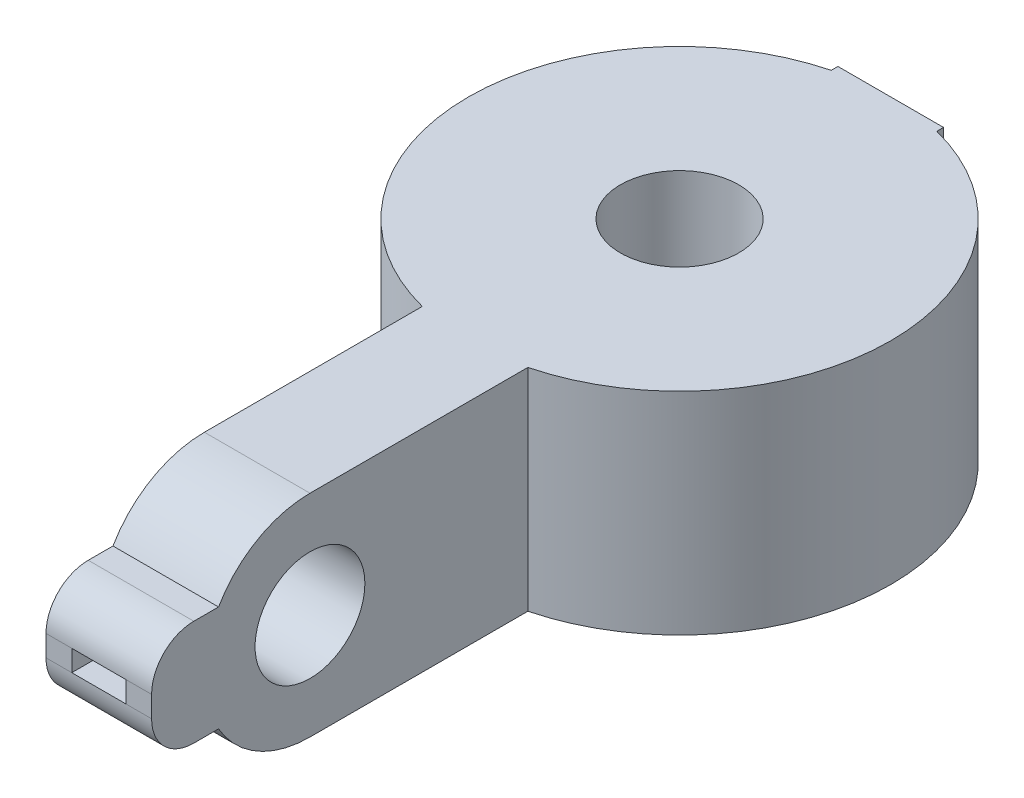
from build123d import *

# Parameters (mm, degrees)
SKETCH1_R               = 3.302
BOSS_EXTRUDE1_DEPTH     = 3.175
SKETCH2_R               = 12.7
BOSS_EXTRUDE2_DEPTH     = 12.7
CUT_EXTRUDE1_REACH      = 44.121
SKETCH3_R               = 3.556
SKETCH4_R               = 9.921875
CUT_EXTRUDE2_DEPTH      = 6.35
CUT_EXTRUDE3_REACH      = 51.697
CUT_EXTRUDE3_END_RADIUS = 9.921875
SKETCH5_W               = 1.27
SKETCH5_H               = 3.2004
SKETCH6_W               = 3.2512
SKETCH6_H               = 1.27
CUT_EXTRUDE4_DEPTH      = 3.175
FILLET2_R               = 2.54


with BuildPart() as part:
    # Sketch1 → Boss-Extrude1 (new, symmetric)
    with BuildSketch(Plane(origin=(0, 0, 0), x_dir=(0, 0, -1), z_dir=(1, 0, 0))):
        with BuildLine():
            Line((0, -6.35), (38.1, -6.35))
            Line((38.1, -6.35), (38.1, 6.35))
            Line((38.1, 6.35), (0, 6.35))
            ThreePointArc((0, 6.35), (-3.175, 5.499261314), (-5.499261314, 3.175))
            Line((-5.499261314, 3.175), (-9.525, 3.175))
            Line((-9.525, 3.175), (-9.525, -3.175))
            Line((-9.525, -3.175), (-5.499261314, -3.175))
            ThreePointArc((-5.499261314, -3.175), (-3.175, -5.499261314), (0, -6.35))
        make_face()
        Circle(SKETCH1_R, mode=Mode.SUBTRACT)
    extrude(amount=BOSS_EXTRUDE1_DEPTH, both=True)

    # Sketch2 → Boss-Extrude2 (add)
    with BuildSketch(Plane(origin=(0, 6.35, 0), x_dir=(1, 0, 0), z_dir=(0, 1, 0))):
        with Locations((0, 25.4)):
            Circle(SKETCH2_R)
    extrude(amount=-BOSS_EXTRUDE2_DEPTH)

    # Sketch3 → Cut-Extrude1 (cut, up to next)
    with BuildSketch(Plane.XZ.offset(6.35), mode=Mode.PRIVATE) as cut_extrude1_sk1:
        with Locations(Location((0, -25.4, 0), (0, 0, 270))):
            Circle(SKETCH3_R)
    cut_extrude1_tool1 = extrude(cut_extrude1_sk1.sketch, amount=-CUT_EXTRUDE1_REACH, mode=Mode.PRIVATE) & part.part
    add(cut_extrude1_tool1.solids().sort_by_distance((0, -6.35, -25.4))[0], mode=Mode.SUBTRACT)

    # Sketch4 → Cut-Extrude2 (cut)
    with BuildSketch(Plane.XZ.offset(6.35)):
        with Locations(Location((0, -25.4, 0), (0, 0, 270))):
            Circle(SKETCH4_R)
    extrude(amount=-CUT_EXTRUDE2_DEPTH, mode=Mode.SUBTRACT)

    # Cut-Extrude3: up to this cylinder (the profile starts outside it)
    cut_extrude3_end = Plane(origin=(0, 1.5748, -25.4), z_dir=(0, -1, 0)) * Cylinder(CUT_EXTRUDE3_END_RADIUS, 124.23775, mode=Mode.PRIVATE)
    # Sketch5 → Cut-Extrude3 (cut, up to the surface)
    with BuildSketch(Plane(origin=(0, 0, -38.1), x_dir=(-1, 0, 0), z_dir=(0, 0, -1)), mode=Mode.PRIVATE) as cut_extrude3_sk1:
        with Locations((0, 1.5748)):
            Rectangle(SKETCH5_W, SKETCH5_H)
    cut_extrude3_tool1 = extrude(cut_extrude3_sk1.sketch, amount=-CUT_EXTRUDE3_REACH, mode=Mode.PRIVATE) - cut_extrude3_end
    add(cut_extrude3_tool1.solids().sort_by_distance((0, 1.5748, -38.1))[0], mode=Mode.SUBTRACT)

    # Sketch6 → Cut-Extrude4 (cut)
    with BuildSketch(Plane.XY.offset(9.525)):
        Rectangle(SKETCH6_W, SKETCH6_H)
    extrude(amount=-CUT_EXTRUDE4_DEPTH, mode=Mode.SUBTRACT)

    # Fillet2
    fillet2_edges = [part.edges().sort_by_distance(p)[0] for p in [
        (0, -3.175, 9.525),
        (0, 3.175, 9.525),
    ]]
    fillet(fillet2_edges, radius=FILLET2_R - 0.0001)  # a hair under: the kernel refuses the full size


solid = part.part
